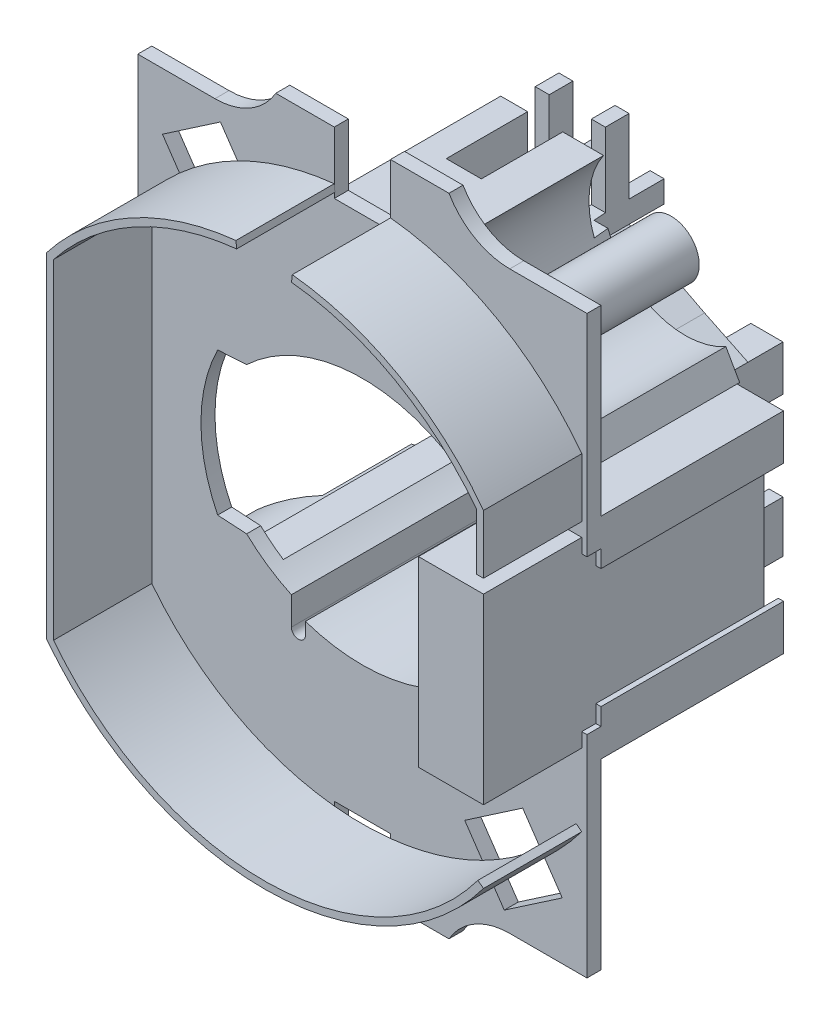
from build123d import *

# Parameters (mm, degrees)
BASE_EXTRUSION_DEPTH    = 1
BOSS_EXTRU_1_DEPTH      = 7
ESQUISSE3_R             = 2
BOSS_EXTRU_2_DEPTH      = 12
BOSS_EXTRU_3_START      = 13
BOSS_EXTRU_3_DEPTH      = 13
ESQUISSE6_W             = 4.629840508
ESQUISSE6_H             = 13
BOSS_EXTRU_4_DEPTH      = 20
BOSS_EXTRU_MINCE1_DEPTH = 18
BOSS_EXTRU_MINCE2_DEPTH = 18
ESQUISSE9_W             = 6
ESQUISSE9_H             = 6.339506173
ENL_V_MAT_EXTRU_1_DEPTH = 18
ESQUISSE10_W            = 2.501729982
ESQUISSE10_H            = 6.798883004
ENL_V_MAT_EXTRU_2_DEPTH = 48
ENL_V_MAT_EXTRU_3_DEPTH = 24
ENL_V_MAT_EXTRU_4_DEPTH = 13


with BuildPart() as part:
    # Esquisse1 → Base-Extrusion (new body)
    with BuildSketch(Plane.XY):
        with BuildLine():
            Line((16, -20.5), (16, -5.483783248))
            Line((16, -5.483783248), (15.629840508, -5.483783248))
            Line((15.629840508, -5.483783248), (15.629840508, -6.5))
            Line((15.629840508, -6.5), (11, -6.5))
            Line((11, -6.5), (11, 6.5))
            Line((11, 6.5), (15.629840508, 6.5))
            Line((15.629840508, 6.5), (15.629840508, 5.483783248))
            Line((15.629840508, 5.483783248), (16, 5.483783248))
            Line((16, 5.483783248), (16, 20.5))
            Line((16, 20.5), (10.5, 20.5))
            ThreePointArc((10.5, 20.5), (8, 21.169872981), (6.169872981, 23))
            Line((6.169872981, 23), (2, 23))
            Line((2, 23), (2, 18.594904529))
            Line((2, 18.594904529), (-2, 18.594904529))
            Line((-2, 18.594904529), (-2, 23))
            Line((-2, 23), (-6.169872981, 23))
            ThreePointArc((-6.169872981, 23), (-8, 21.169872981), (-10.5, 20.5))
            Line((-10.5, 20.5), (-16, 20.5))
            Line((-16, 20.5), (-16, -20.5))
            Line((-16, -20.5), (-10.5, -20.5))
            ThreePointArc((-10.5, -20.5), (-8, -21.169872981), (-6.169872981, -23))
            Line((-6.169872981, -23), (-2, -23))
            Line((-2, -23), (-2, -18.594904529))
            Line((-2, -18.594904529), (2, -18.594904529))
            Line((2, -18.594904529), (2, -23))
            Line((2, -23), (6.169872981, -23))
            ThreePointArc((6.169872981, -23), (8, -21.169872981), (10.5, -20.5))
            Line((10.5, -20.5), (16, -20.5))
        make_face()
        with BuildLine():
            Line((5.22395578, -8.065856147), (5.22395578, -9.393419517))
            ThreePointArc((5.22395578, -9.393419517), (5.479098581, -9.829360972), (5.984135588, -9.820393132))
            ThreePointArc((5.984135588, -9.820393132), (8.482022928, -7.765647883), (10.308953765, -5.096613804))
            ThreePointArc((10.308953765, -5.096613804), (10.406458976, -4.894447015), (10.5, -4.69041576))
            Line((10.5, -4.69041576), (10.5, 4.69041576))
            ThreePointArc((10.5, 4.69041576), (10.406458976, 4.894447015), (10.308953765, 5.096613804))
            Line((10.308953765, 5.096613804), (8.24431514, 5.219591038))
            ThreePointArc((8.24431514, 5.219591038), (0, 8.5), (-8.24431514, 5.219591038))
            Line((-8.24431514, 5.219591038), (-10.308953765, 5.096613804))
            ThreePointArc((-10.308953765, 5.096613804), (-11.5, 0), (-10.308953765, -5.096613804))
            Line((-10.308953765, -5.096613804), (-8.24431514, -5.219591038))
            ThreePointArc((-8.24431514, -5.219591038), (-6.737808544, -6.429850755), (-5.056573228, -7.382603879))
            Line((-5.056573228, -7.382603879), (-5.056573228, -9.382603879))
            ThreePointArc((-5.056573228, -9.382603879), (-4.556573228, -9.882603879), (-4.056573228, -9.382603879))
            Line((-4.056573228, -9.382603879), (-4.056573228, -8.525096925))
            ThreePointArc((-4.056573228, -8.525096925), (0.627232835, -9.175382494), (5.22395578, -8.065856147))
        make_face(mode=Mode.SUBTRACT)
        Polygon((-14.240317926, 16.438677603), (-10.109862881, 19.256361247), (-7.292179236, 15.125906202), (-11.422634281, 12.308222558), align=None, mode=Mode.SUBTRACT)
        Polygon((10.109862881, -19.256361247), (14.240317926, -16.438677603), (11.422634281, -12.308222558), (7.292179236, -15.125906202), align=None, mode=Mode.SUBTRACT)
    extrude(amount=BASE_EXTRUSION_DEPTH)

    # Esquisse2 → Boss.-Extru.1 (add)
    with BuildSketch(Plane.XY.offset(1)):
        with BuildLine():
            Line((15.129840508, 7.472424851), (15.129840508, 11.492951153))
            ThreePointArc((15.129840508, 11.492951153), (9.310646956, 16.562362551), (1.955275435, 18.899124265))
            Line((1.955275435, 18.899124265), (2.006730052, 19.39646964))
            ThreePointArc((2.006730052, 19.39646964), (9.629381267, 16.956562635), (15.629840508, 11.66010659))
            Line((15.629840508, 11.66010659), (15.629840508, 7.472424851))
            Line((15.629840508, 7.472424851), (15.129840508, 7.472424851))
        make_face()
        with BuildLine():
            Line((-15.5, 12), (-15.5, -11.832159566))
            ThreePointArc((-15.5, -11.832159566), (0.107773819, -19.499702172), (15.629840508, -11.66010659))
            Line((15.629840508, -11.66010659), (15.229075367, -11.361129498))
            ThreePointArc((15.229075367, -11.361129498), (0.189037495, -18.999059577), (-15, -11.66190379))
            Line((-15, -11.66190379), (-15, 11.82783599))
            ThreePointArc((-15, 11.82783599), (-9.205408387, 16.737925817), (-1.955543954, 19.001935482))
            Line((-1.955543954, 19.001935482), (-2.006730052, 19.499308565))
            ThreePointArc((-2.006730052, 19.499308565), (-9.522673286, 17.13384643), (-15.5, 12))
        make_face()
    extrude(amount=BOSS_EXTRU_1_DEPTH)

    # Esquisse3 → Boss.-Extru.2 (add)
    with BuildSketch(Plane(origin=(0, 0, 0), x_dir=(-1, 0, 0), z_dir=(0, 0, -1))):
        with Locations((-9, 14.5)):
            Circle(ESQUISSE3_R)
        with Locations((9, -14.5)):
            Circle(ESQUISSE3_R)
    extrude(amount=BOSS_EXTRU_2_DEPTH)

    # Esquisse4 → Boss.-Extru.3 (add)
    with BuildSketch(Plane(origin=(0, 0, 0), x_dir=(-1, 0, 0), z_dir=(0, 0, -1)).offset(BOSS_EXTRU_3_START)):
        with BuildLine():
            Line((-15.629840508, 6.5), (-15.629840508, 4.255909067))
            Line((-15.629840508, 4.255909067), (-16, 4.255909067))
            Line((-16, 4.255909067), (-16, 7.490775995))
            Line((-16, 7.490775995), (-12.530985065, 7.490775995))
            ThreePointArc((-12.530985065, 7.490775995), (-12.704958558, 7.581159146), (-12.876620197, 7.675859576))
            Line((-12.876620197, 7.675859576), (-11.894481775, 9.404749736))
            ThreePointArc((-11.894481775, 9.404749736), (-4.675335359, 10.545651034), (-4.183517489, 17.83782807))
            Line((-4.183517489, 17.83782807), (3.142592691, 17.83782807))
            Line((3.142592691, 17.83782807), (4.306719898, 9.82111721))
            ThreePointArc((4.306719898, 9.82111721), (7.138270289, 8.543466996), (9.618367663, 6.672856211))
            Line((9.618367663, 6.672856211), (8.24431514, 5.219591038))
            ThreePointArc((8.24431514, 5.219591038), (0, 8.5), (-8.24431514, 5.219591038))
            Line((-8.24431514, 5.219591038), (-8.24431514, -8.01755997))
            ThreePointArc((-8.24431514, -8.01755997), (-7.17110552, -8.990286181), (-5.984135588, -9.820393132))
            ThreePointArc((-5.984135588, -9.820393132), (-5.479098581, -9.829360972), (-5.22395578, -9.393419517))
            Line((-5.22395578, -9.393419517), (-5.22395578, -8.065856147))
            ThreePointArc((-5.22395578, -8.065856147), (-0.627232835, -9.175382494), (4.056573228, -8.525096925))
            Line((4.056573228, -8.525096925), (4.056573228, -9.382603879))
            ThreePointArc((4.056573228, -9.382603879), (4.556573228, -9.882603879), (5.056573228, -9.382603879))
            Line((5.056573228, -9.382603879), (5.056573228, -7.382603879))
            ThreePointArc((5.056573228, -7.382603879), (5.861547298, -6.971020164), (6.633249581, -6.5))
            Line((6.633249581, -6.5), (9, -6.5))
            Line((9, -6.5), (9, -7.642592691))
            ThreePointArc((9, -7.642592691), (11.295304561, -8.038141755), (13.325813542, -9.179156815))
            Line((13.325813542, -9.179156815), (12.828918694, -10.067325636))
            ThreePointArc((12.828918694, -10.067325636), (6.562615742, -9.173802636), (3.142592691, -14.5))
            Line((3.142592691, -14.5), (3.142592691, -17.83782807))
            Line((3.142592691, -17.83782807), (-3.142592691, -17.83782807))
            Line((-3.142592691, -17.83782807), (-3.142592691, -13.699371887))
            Line((-3.142592691, -13.699371887), (-10.911086471, -7.490775995))
            Line((-10.911086471, -7.490775995), (-16, -7.490775995))
            Line((-16, -7.490775995), (-16, -4.255909067))
            Line((-16, -4.255909067), (-15.629840508, -4.255909067))
            Line((-15.629840508, -4.255909067), (-15.629840508, -6.5))
            Line((-15.629840508, -6.5), (-11, -6.5))
            Line((-11, -6.5), (-11, 6.5))
            Line((-11, 6.5), (-15.629840508, 6.5))
        make_face()
    extrude(amount=-BOSS_EXTRU_3_DEPTH)

    # Esquisse6 → Boss.-Extru.4 (add)
    with BuildSketch(Plane(origin=(0, 0, -12), x_dir=(-1, 0, 0), z_dir=(0, 0, -1))):
        with Locations((-13.314920254, 0)):
            Rectangle(ESQUISSE6_W, ESQUISSE6_H)
    extrude(amount=-BOSS_EXTRU_4_DEPTH)

    # Esquisse7 → Boss.-Extru.-Mince1 (add)
    with BuildSketch(Plane(origin=(0, 0, 0), x_dir=(-1, 0, 0), z_dir=(0, 0, -1))):
        Polygon((-3.595949751, -12.902317522), (-10.968702621, -6.5), (-10.968702621, 6.725146199), (-7.880116959, 8.219623132), (-2.5, 11), (-2.5, 17.83782807), (-1.5, 17.83782807), (-1.5, 10.39114573), (-7.432706612, 7.32519747), (-9.968702621, 6.098102627), (-9.968702621, -6.043960133), (-2.940282729, -12.147267354), align=None)
    extrude(amount=BOSS_EXTRU_MINCE1_DEPTH)

    # Esquisse8 → Boss.-Extru.-Mince2 (add)
    with BuildSketch(Plane(origin=(0, 0, 0), x_dir=(-1, 0, 0), z_dir=(0, 0, -1))):
        Polygon((2.5, 17.83782807), (2.5, 12.347336579), (7.527396813, 7.476476153), (6.831559609, 6.758276608), (1.5, 11.923829214), (1.5, 17.83782807), align=None)
    extrude(amount=BOSS_EXTRU_MINCE2_DEPTH)

    # Esquisse9 → Enlèv. mat.-Extru.1 (cut)
    with BuildSketch(Plane(origin=(10.968702621, 0, 0), x_dir=(0, 0, -1), z_dir=(1, 0, 0))):
        with Locations((15, 0.330246913)):
            Rectangle(ESQUISSE9_W, ESQUISSE9_H)
    extrude(amount=-ENL_V_MAT_EXTRU_1_DEPTH, mode=Mode.SUBTRACT)

    # Esquisse10 → Enlèv. mat.-Extru.2 (cut)
    with BuildSketch(Plane(origin=(0, 17.83782807, 0), x_dir=(-1, 0, 0), z_dir=(0, 1, 0))):
        with Locations((-0.026071122, -9.600558498)):
            Rectangle(ESQUISSE10_W, ESQUISSE10_H)
    extrude(amount=-ENL_V_MAT_EXTRU_2_DEPTH, mode=Mode.SUBTRACT)

    # Esquisse11 → Enlèv. mat.-Extru.3 (cut, symmetric)
    with BuildSketch(Plane(origin=(0, 0, 0), x_dir=(0, 0, -1), z_dir=(1, 0, 0))):
        Polygon((15.5, -6.806521876), (18.836495156, -6.806521876), (18.836495156, 6.725146199), (15.5, 6.725146199), (15.5, 11), (18.836495156, 11), (18.836495156, 12.55993843), (15.5, 12.55993843), (15.5, 19.696656984), (13.812828158, 19.696656984), (13.812828158, 12.55993843), (12, 12.419447164), (12, 21.622150769), (19.286830253, 21.622150769), (19.286830253, -12.902317522), (15.5, -12.902317522), align=None)
    extrude(amount=ENL_V_MAT_EXTRU_3_DEPTH, both=True, mode=Mode.SUBTRACT)

    # Esquisse12 → Enlèv. mat.-Extru.4 (cut)
    with BuildSketch(Plane(origin=(0, 0, 0), x_dir=(1, 0, 0), z_dir=(0, 1, 0))):
        Polygon((-15.26932626, 16.896694403), (-10.5, 16.896694403), (-10.5, 6.661251895), (-15.26932626, 3.531077729), align=None)
    extrude(amount=-ENL_V_MAT_EXTRU_4_DEPTH, mode=Mode.SUBTRACT)


solid = part.part
